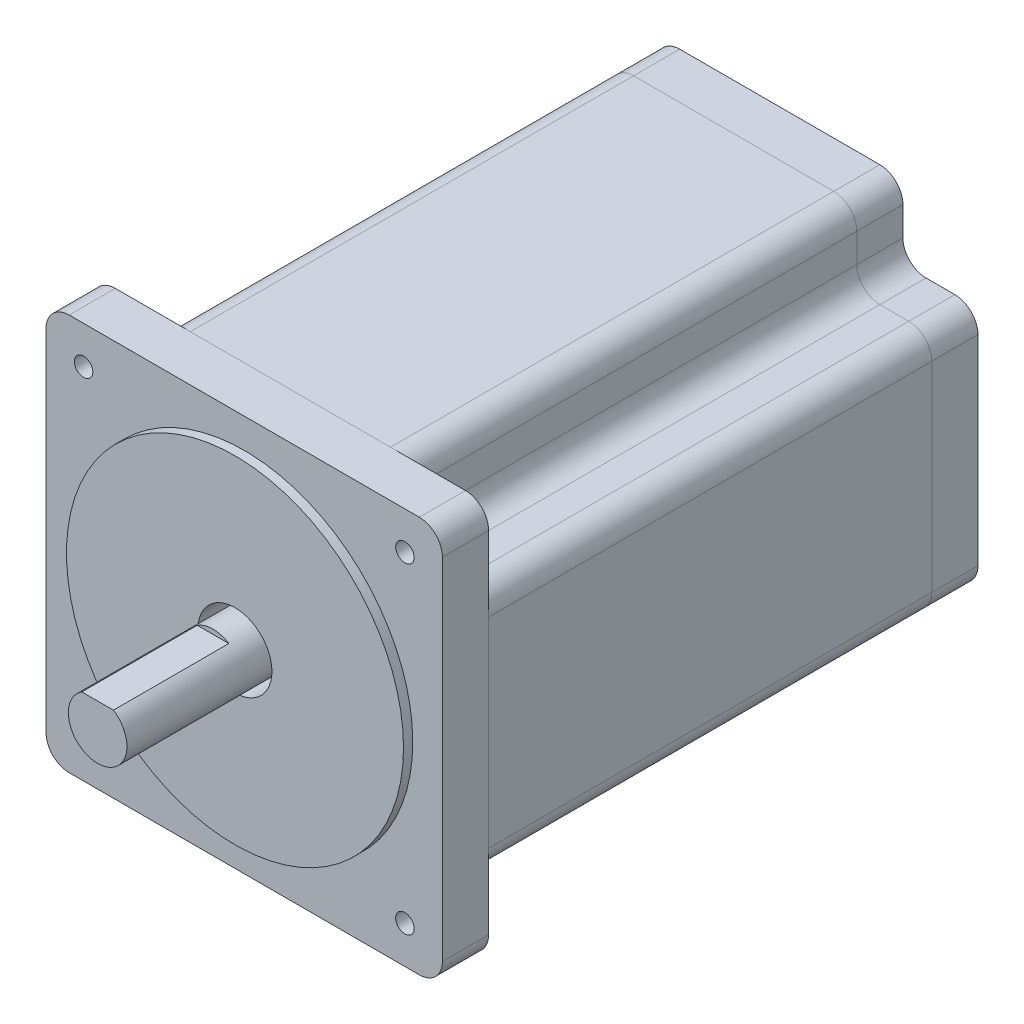
from build123d import *

# Parameters (mm, degrees)
SZKIC1_W                    = 85.85
SZKIC1_H                    = 85.85
DODANIE_WYCI_GNI_CIE2_DEPTH = 116
SZKIC3_R                    = 36.5
DODANIE_WYCI_GNI_CIE3_DEPTH = 2
SZKIC5_W                    = 16.25
SZKIC5_H                    = 16.25
WYTNIJ_WYCI_GNI_CIE1_DEPTH  = 106
SZYK_LINIOWY1_COUNT         = 2
SZYK_LINIOWY1_PITCH         = 69.6
SZYK_LINIOWY1_COUNT_DIR2    = 2
SZYK_LINIOWY1_PITCH_DIR2    = 69.6
SZKIC6_R                    = 2
WYTNIJ_WYCI_GNI_CIE2_DEPTH  = 10
SZYK_LINIOWY2_COUNT         = 2
SZYK_LINIOWY2_PITCH         = 69.6
SZYK_LINIOWY2_COUNT_DIR2    = 2
SZYK_LINIOWY2_PITCH_DIR2    = 69.6
SZKIC7_R                    = 6.35
DODANIE_WYCI_GNI_CIE4_DEPTH = 29.75
WYTNIJ_WYCI_GNI_CIE5_START  = -10
SZKIC8_R                    = 8
SZKIC8_R_2                  = 6.35
WYTNIJ_WYCI_GNI_CIE5_DEPTH  = 10
SZKIC10_W                   = 7.613497133
SZKIC10_H                   = 1
WYTNIJ_WYCI_GNI_CIE6_DEPTH  = 25
ZAOKR_GLENIE1_R             = 5
ZAOKR_GLENIE2_R             = 5
ZAOKR_GLENIE3_R             = 5


with BuildPart() as part:
    # Szkic1 → Dodanie-wyciągnięcie2 (new body)
    with BuildSketch(Plane.XY):
        Rectangle(SZKIC1_W, SZKIC1_H)
    extrude(amount=DODANIE_WYCI_GNI_CIE2_DEPTH)

    # Szkic3 → Dodanie-wyciągnięcie3 (add)
    with BuildSketch(Plane.XY.offset(116)):
        Circle(SZKIC3_R)
    extrude(amount=DODANIE_WYCI_GNI_CIE3_DEPTH)

    # Szkic5 → Wytnij-wyciągnięcie1 (cut)
    with BuildSketch(Plane(origin=(0, 0, 0), x_dir=(-1, 0, 0), z_dir=(0, 0, -1))):
        with Locations((-34.8, 34.8)):
            Rectangle(SZKIC5_W, SZKIC5_H)
    wytnij_wyci_gni_cie1 = extrude(amount=-WYTNIJ_WYCI_GNI_CIE1_DEPTH, mode=Mode.SUBTRACT)

    # Szyk liniowy1: Wytnij-wyci_gni_cie1 2 × 2
    with Locations(*[(-i * SZYK_LINIOWY1_PITCH, -j * SZYK_LINIOWY1_PITCH_DIR2, 0) for i in range(SZYK_LINIOWY1_COUNT) for j in range(SZYK_LINIOWY1_COUNT_DIR2) if (i, j) != (0, 0)]):
        add(wytnij_wyci_gni_cie1, mode=Mode.SUBTRACT)

    # Szkic6 → Wytnij-wyciągnięcie2 (cut)
    with BuildSketch(Plane.XY.offset(116)):
        with Locations((-34.8, 34.8)):
            Circle(SZKIC6_R)
    wytnij_wyci_gni_cie2 = extrude(amount=-WYTNIJ_WYCI_GNI_CIE2_DEPTH, mode=Mode.SUBTRACT)

    # Szyk liniowy2: Wytnij-wyci_gni_cie2 2 × 2
    with Locations(*[(i * SZYK_LINIOWY2_PITCH, -j * SZYK_LINIOWY2_PITCH_DIR2, 0) for i in range(SZYK_LINIOWY2_COUNT) for j in range(SZYK_LINIOWY2_COUNT_DIR2) if (i, j) != (0, 0)]):
        add(wytnij_wyci_gni_cie2, mode=Mode.SUBTRACT)

    # Szkic7 → Dodanie-wyciągnięcie4 (add)
    with BuildSketch(Plane.XY.offset(118)):
        Circle(SZKIC7_R)
    extrude(amount=DODANIE_WYCI_GNI_CIE4_DEPTH)

    # Szkic8 → Wytnij-wyciągnięcie5 (cut)
    with BuildSketch(Plane.XY.offset(118).offset(WYTNIJ_WYCI_GNI_CIE5_START)):
        Circle(SZKIC8_R)
        Circle(SZKIC8_R_2, mode=Mode.SUBTRACT)
    extrude(amount=WYTNIJ_WYCI_GNI_CIE5_DEPTH, mode=Mode.SUBTRACT)

    # Szkic10 → Wytnij-wyciągnięcie6 (cut)
    with BuildSketch(Plane.XY.offset(147.75)):
        with Locations((-0.198356944, 5.85)):
            Rectangle(SZKIC10_W, SZKIC10_H)
    extrude(amount=-WYTNIJ_WYCI_GNI_CIE6_DEPTH, mode=Mode.SUBTRACT)

    # Zaokrąglenie1
    zaokr_glenie1_edges = [part.edges().sort_by_distance(p)[0] for p in [
        (-42.925, -42.925, 111),
        (42.925, -42.925, 111),
        (-42.925, 42.925, 111),
        (42.925, 42.925, 111),
    ]]
    fillet(zaokr_glenie1_edges, radius=ZAOKR_GLENIE1_R)

    # Zaokrąglenie2
    zaokr_glenie2_edges = [part.edges().sort_by_distance(p)[0] for p in [
        (42.925, -26.675, 53),
        (-42.925, 26.675, 53),
        (26.675, -42.925, 53),
        (-26.675, -42.925, 53),
        (-42.925, -26.675, 53),
        (-26.675, 42.925, 53),
        (26.675, 42.925, 53),
        (42.925, 26.675, 53),
    ]]
    fillet(zaokr_glenie2_edges, radius=ZAOKR_GLENIE2_R)

    # Zaokrąglenie3
    zaokr_glenie3_edges = [part.edges().sort_by_distance(p)[0] for p in [
        (26.675, -26.675, 53),
        (26.675, 26.675, 53),
        (-26.675, 26.675, 53),
        (-26.675, -26.675, 53),
    ]]
    fillet(zaokr_glenie3_edges, radius=ZAOKR_GLENIE3_R)


solid = part.part
